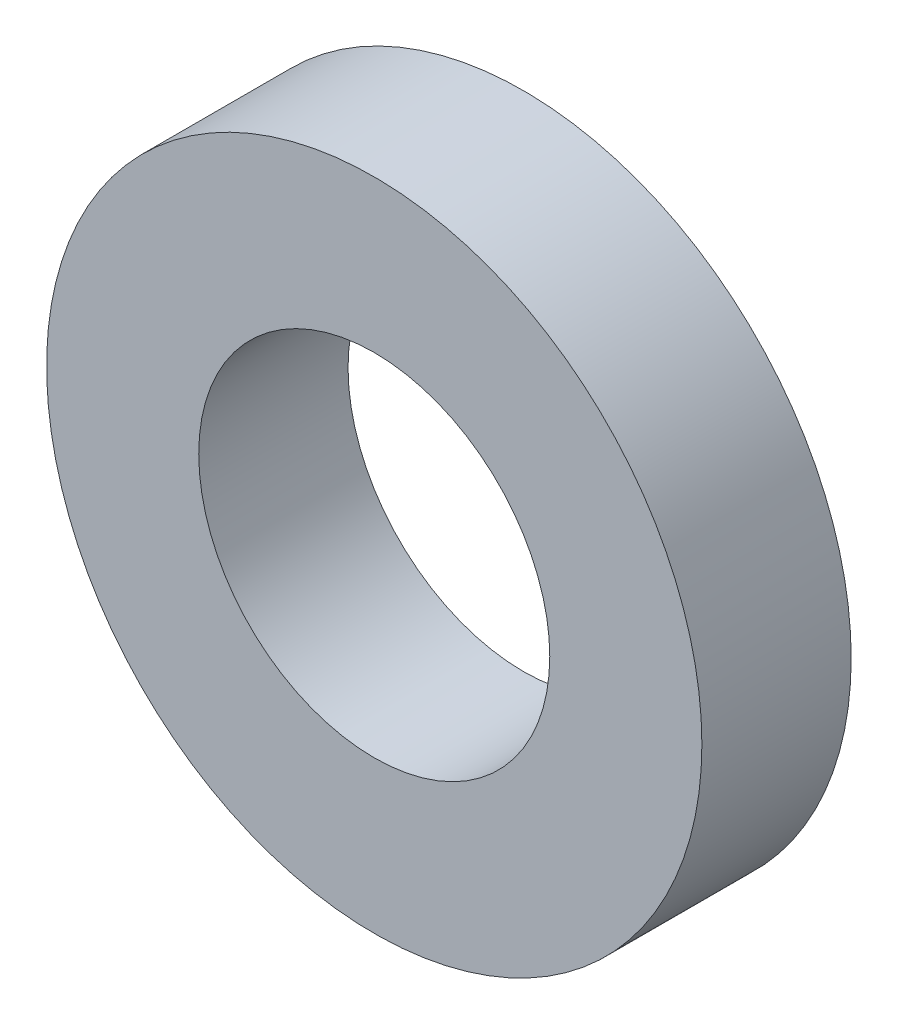
from build123d import *

# Parameters (mm, degrees)
SKETCH1_R           = 8.89
SKETCH1_R_2         = 4.7625
BOSS_EXTRUDE1_DEPTH = 2.02565


with BuildPart() as part:
    # Sketch1 → Boss-Extrude1 (new, symmetric)
    with BuildSketch(Plane.XY):
        Circle(SKETCH1_R)
        Circle(SKETCH1_R_2, mode=Mode.SUBTRACT)
    extrude(amount=BOSS_EXTRUDE1_DEPTH, both=True)


solid = part.part
